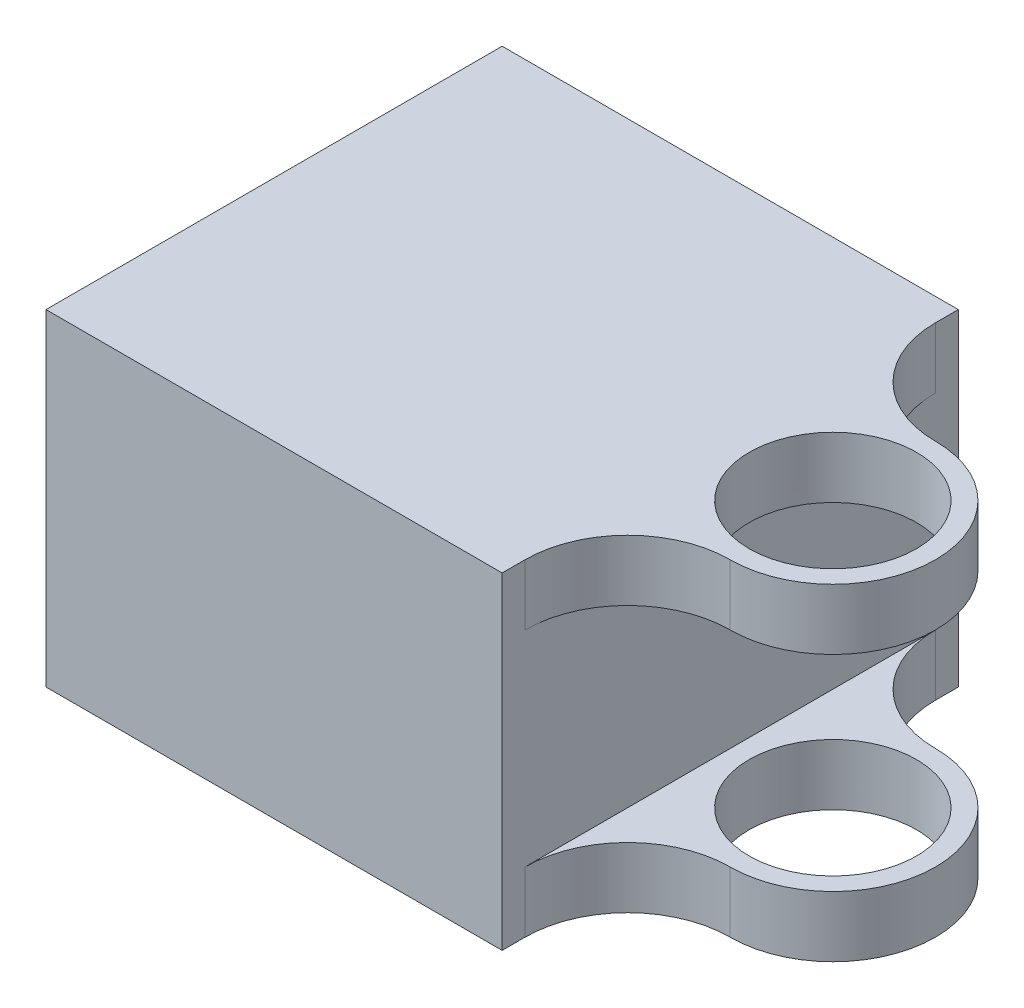
from build123d import *

# Parameters (mm, degrees)
SKETCH_1_R               = 11
EXTRUDE_1_DEPTH          = 21.5
CUT_EXTRUDE_1_DEPTH      = 83.246580476
CUT_EXTRUDE_1_DEPTH_BACK = 83.246580476
SKETCH_2_W               = 27
SKETCH_2_H               = 27


with BuildPart() as part:
    # Эскиз1 → Бобышка-Вытянуть1 (new, symmetric)
    with BuildSketch(Plane(origin=(0, 0, 0), x_dir=(1, 0, 0), z_dir=(0, 1, 0))):
        with BuildLine():
            ThreePointArc((0, -13.5), (9.545941546, -9.545941546), (13.5, 0))
            ThreePointArc((13.5, 0), (9.545941546, 9.545941546), (0, 13.5))
            ThreePointArc((0, 13.5), (-9.545941546, 17.454058454), (-13.5, 27))
            Line((-13.5, 27), (-13.5, 30))
            Line((-13.5, 30), (-73.5, 30))
            Line((-73.5, 30), (-73.5, -30))
            Line((-73.5, -30), (-13.5, -30))
            Line((-13.5, -30), (-13.5, -27))
            ThreePointArc((-13.5, -27), (-9.545941546, -17.454058454), (0, -13.5))
        make_face()
        Circle(SKETCH_1_R, mode=Mode.SUBTRACT)
    extrude(amount=EXTRUDE_1_DEPTH, both=True)

    # Эскиз2 → Вырез-Вытянуть1 (cut, two sides: drawn at the far end of the back side and taken through both)
    with BuildSketch(Plane.XY.offset(-CUT_EXTRUDE_1_DEPTH_BACK)):
        Rectangle(SKETCH_2_W, SKETCH_2_H)
    extrude(amount=CUT_EXTRUDE_1_DEPTH + CUT_EXTRUDE_1_DEPTH_BACK, mode=Mode.SUBTRACT)


solid = part.part
